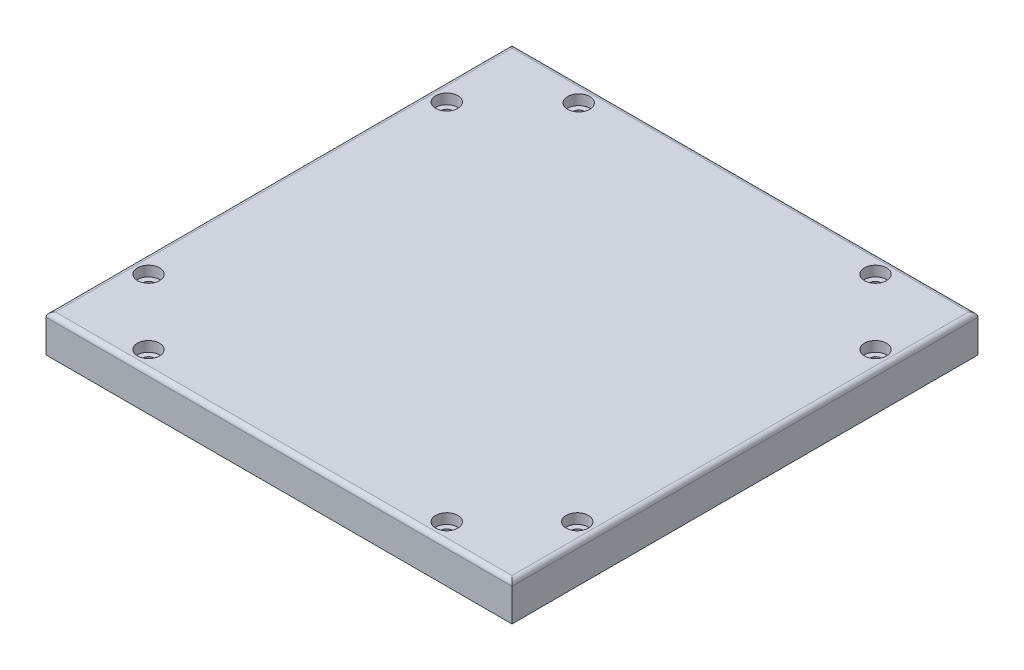
from build123d import *

# Parameters (mm, degrees)
SKETCH3_W                                      = 100
SKETCH3_H                                      = 100
BOSS_EXTRUDE2_DEPTH                            = 8
CBORE_FOR_2_SOCKET_HEAD_CAP_SCREW1_D           = 2.4384
CBORE_FOR_2_SOCKET_HEAD_CAP_SCREW1_CBORE_D     = 4.7625
CBORE_FOR_2_SOCKET_HEAD_CAP_SCREW1_CBORE_DEPTH = 2.1844
FILLET1_R                                      = 1


with BuildPart() as part:
    # Sketch3 → Boss-Extrude2 (new body)
    with BuildSketch(Plane(origin=(0, 0, 0), x_dir=(1, 0, 0), z_dir=(0, 1, 0))):
        Rectangle(SKETCH3_W, SKETCH3_H)
    extrude(amount=BOSS_EXTRUDE2_DEPTH)

    # CBORE for #2 Socket Head Cap Screw1 (through all)
    with Locations(Plane(origin=(-46, 8, 32), x_dir=(0, 0, 1), z_dir=(0, 1, 0))):
        with Locations((0, 0), (14, 14), (-64, 0), (-78, 14.320192801), (-78, 78), (-64, 92), (14, 78), (0, 92)):
            CounterBoreHole(CBORE_FOR_2_SOCKET_HEAD_CAP_SCREW1_D / 2, CBORE_FOR_2_SOCKET_HEAD_CAP_SCREW1_CBORE_D / 2, CBORE_FOR_2_SOCKET_HEAD_CAP_SCREW1_CBORE_DEPTH)

    # Fillet1
    fillet1_edges = [part.edges().sort_by_distance(p)[0] for p in [
        (0, 8, 50),
        (-50, 8, 0),
        (0, 8, -50),
        (50, 8, 0),
    ]]
    fillet(fillet1_edges, radius=FILLET1_R)


solid = part.part
